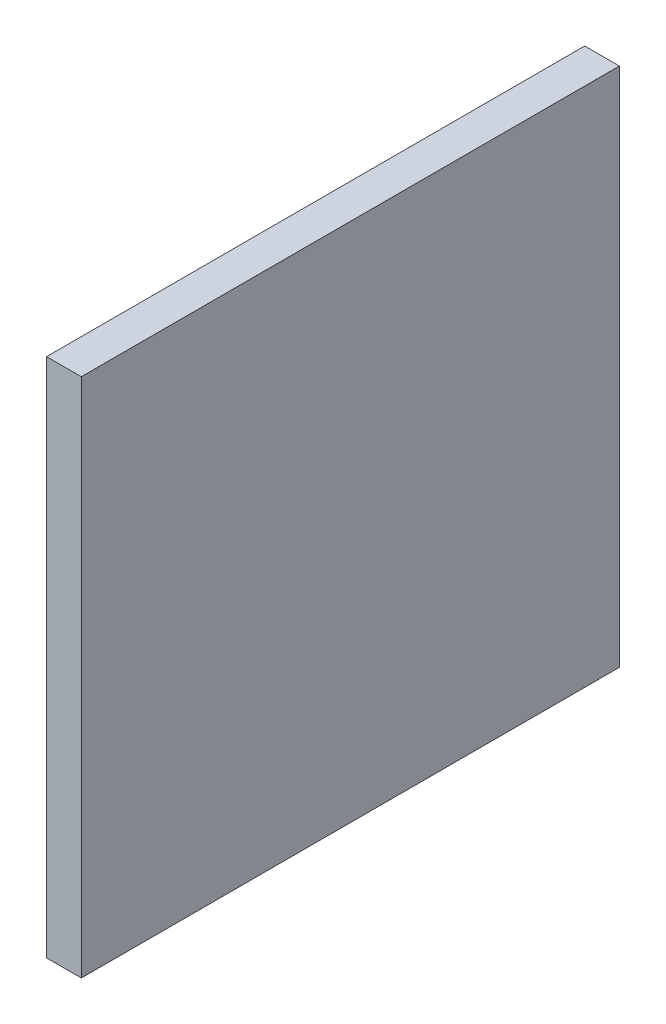
from build123d import *

# Parameters (mm, degrees)
SKETCH1_W           = 10
SKETCH1_H           = 150
BOSS_EXTRUDE1_DEPTH = 155


with BuildPart() as part:
    # Sketch1 → Boss-Extrude1 (new body)
    with BuildSketch(Plane.XY):
        with Locations((155, -75)):
            Rectangle(SKETCH1_W, SKETCH1_H)
    extrude(amount=BOSS_EXTRUDE1_DEPTH)


solid = part.part
